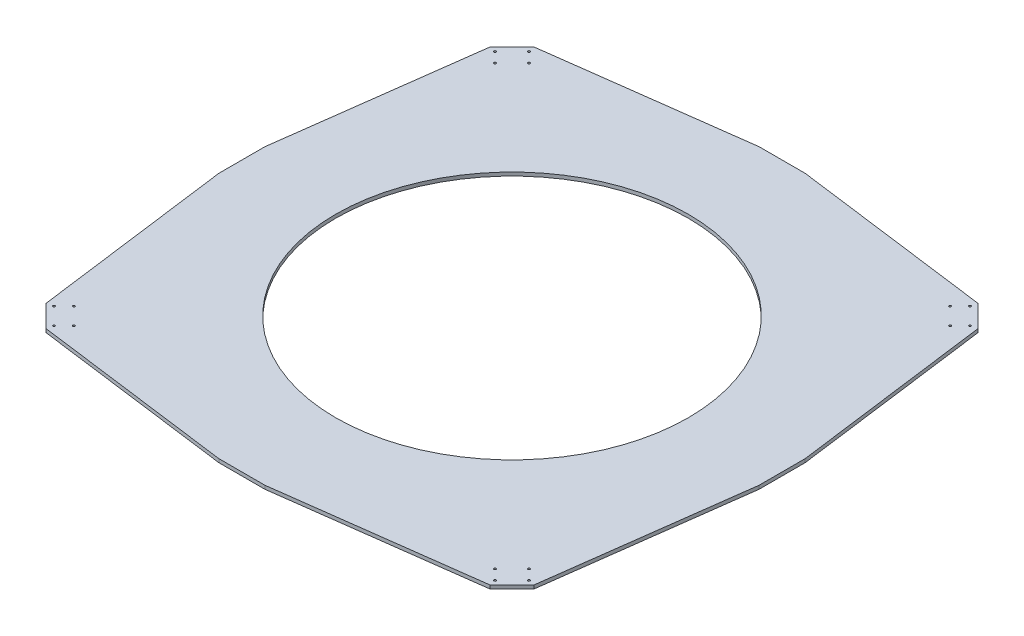
from build123d import *

# Parameters (mm, degrees)
SKETCH_1_R      = 1.5
SKETCH_1_R_2    = 250
EXTRUDE_2_DEPTH = 5


with BuildPart() as part:
    # 草图1 → 凸台-拉伸2 (new body)
    with BuildSketch(Plane(origin=(0, 0, 0), x_dir=(1, 0, 0), z_dir=(0, 1, 0))):
        Polygon((-32.720120417, 383.07477601), (-314.9221712, 345.9221712), (-345.9221712, 314.9221712), (-383.07477601, 32.720120417), (-383.07477601, -32.720120417), (-345.9221712, -314.9221712), (-314.9221712, -345.9221712), (-32.720120417, -383.07477601), (32.720120417, -383.07477601), (314.9221712, -345.9221712), (345.9221712, -314.9221712), (383.07477601, -32.720120417), (383.07477601, 32.720120417), (345.9221712, 314.9221712), (314.9221712, 345.9221712), (32.720120417, 383.07477601), (0, 383.07477601), align=None)
        with Locations((-312.744501669, -336.786132229)):
            Circle(SKETCH_1_R, mode=Mode.SUBTRACT)
        with Locations((-336.786132229, -312.744501669)):
            Circle(SKETCH_1_R, mode=Mode.SUBTRACT)
        with Locations((-298.602366045, -322.643996605)):
            Circle(SKETCH_1_R, mode=Mode.SUBTRACT)
        with Locations((-322.643996605, -298.602366045)):
            Circle(SKETCH_1_R, mode=Mode.SUBTRACT)
        with Locations((312.744501669, -336.786132229)):
            Circle(SKETCH_1_R, mode=Mode.SUBTRACT)
        with Locations((298.602366045, -322.643996605)):
            Circle(SKETCH_1_R, mode=Mode.SUBTRACT)
        with Locations((322.643996605, -298.602366045)):
            Circle(SKETCH_1_R, mode=Mode.SUBTRACT)
        with Locations((336.786132229, -312.744501669)):
            Circle(SKETCH_1_R, mode=Mode.SUBTRACT)
        Circle(SKETCH_1_R_2, mode=Mode.SUBTRACT)
        with Locations((-336.786132229, 312.744501669)):
            Circle(SKETCH_1_R, mode=Mode.SUBTRACT)
        with Locations((-322.643996605, 298.602366045)):
            Circle(SKETCH_1_R, mode=Mode.SUBTRACT)
        with Locations((-298.602366045, 322.643996605)):
            Circle(SKETCH_1_R, mode=Mode.SUBTRACT)
        with Locations((-312.744501669, 336.786132229)):
            Circle(SKETCH_1_R, mode=Mode.SUBTRACT)
        with Locations((322.643996605, 298.602366045)):
            Circle(SKETCH_1_R, mode=Mode.SUBTRACT)
        with Locations((298.602366045, 322.643996605)):
            Circle(SKETCH_1_R, mode=Mode.SUBTRACT)
        with Locations((336.786132229, 312.744501669)):
            Circle(SKETCH_1_R, mode=Mode.SUBTRACT)
        with Locations((312.744501669, 336.786132229)):
            Circle(SKETCH_1_R, mode=Mode.SUBTRACT)
    extrude(amount=EXTRUDE_2_DEPTH)


solid = part.part
